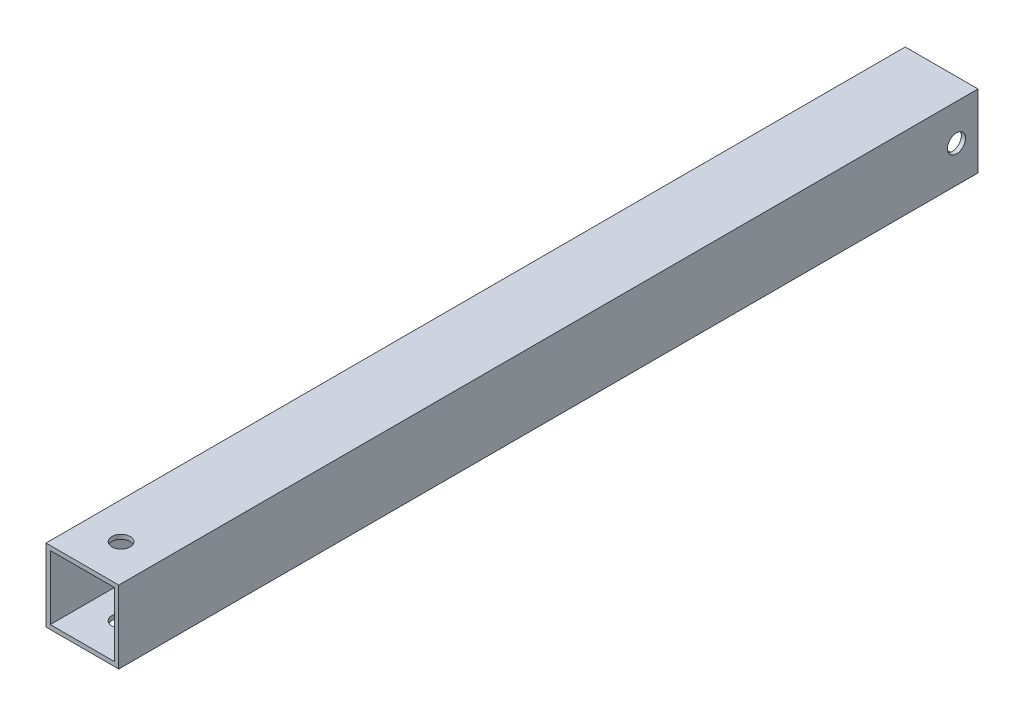
from build123d import *

# Parameters (mm, degrees)
CROQUIS1_W              = 50.8
CROQUIS1_H              = 50.8
CROQUIS1_W_2            = 44.8
CROQUIS1_H_2            = 44.8
SALIENTE_EXTRUIR1_DEPTH = 300
CROQUIS2_R              = 6.35
CORTAR_EXTRUIR1_DEPTH   = 306.32900288
CROQUIS3_R              = 6.35
CORTAR_EXTRUIR2_DEPTH   = 70


with BuildPart() as part:
    # Croquis1 → Saliente-Extruir1 (new, symmetric)
    with BuildSketch(Plane.XY):
        Rectangle(CROQUIS1_W, CROQUIS1_H)
        Rectangle(CROQUIS1_W_2, CROQUIS1_H_2, mode=Mode.SUBTRACT)
    extrude(amount=SALIENTE_EXTRUIR1_DEPTH, both=True)

    # Croquis2 → Cortar-Extruir1 (cut, through all)
    with BuildSketch(Plane(origin=(25.4, 0, 0), x_dir=(0, 0, -1), z_dir=(1, 0, 0))):
        with Locations((285, 0)):
            Circle(CROQUIS2_R)
    extrude(amount=-CORTAR_EXTRUIR1_DEPTH, mode=Mode.SUBTRACT)

    # Croquis3 → Cortar-Extruir2 (cut)
    with BuildSketch(Plane(origin=(0, 25.4, 0), x_dir=(1, 0, 0), z_dir=(0, 1, 0))):
        with Locations((0, -273)):
            Circle(CROQUIS3_R)
    extrude(amount=-CORTAR_EXTRUIR2_DEPTH, mode=Mode.SUBTRACT)


solid = part.part
